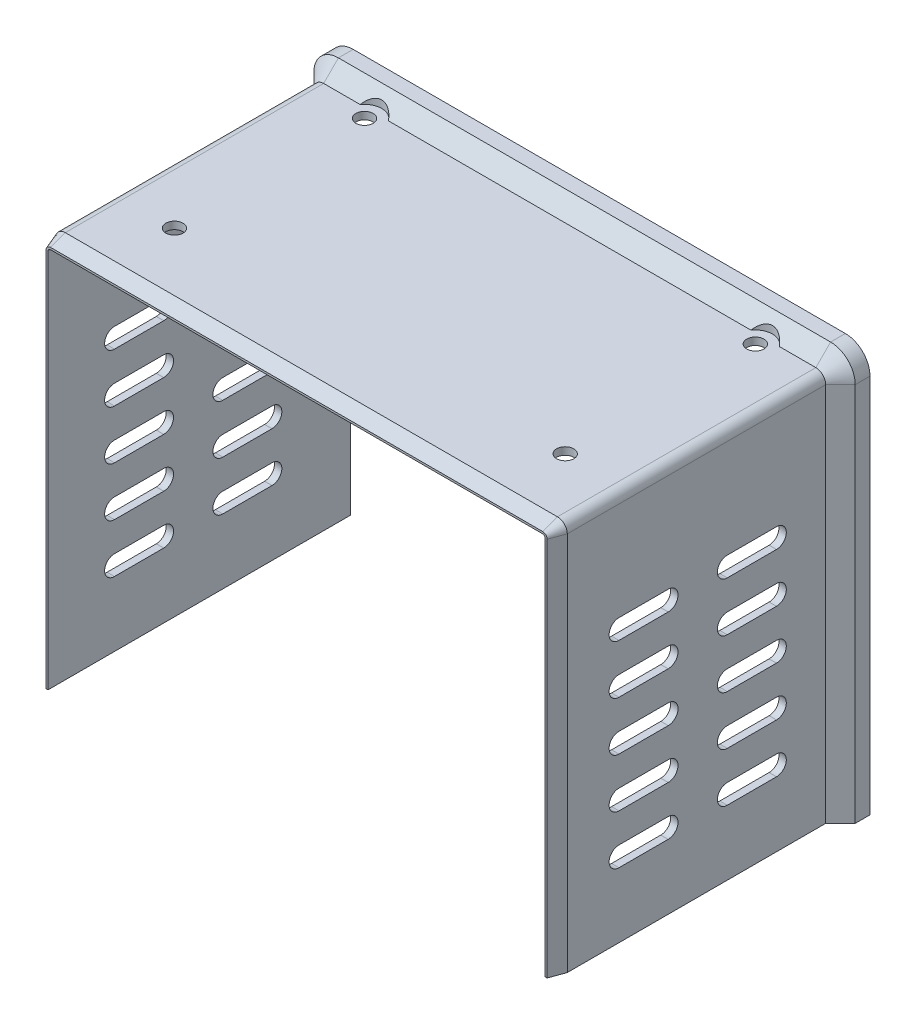
from build123d import *
from OCP.BRepFilletAPI import BRepFilletAPI_MakeChamfer

# Parameters (mm, degrees)
BOSS_EXTRUDE1_DEPTH = 61.5
CHAMFER1_SIZE       = 3
CHAMFER1_SIZE2      = 1.091910703
SKETCH4_R           = 1.75
CUT_EXTRUDE1_DEPTH  = 10
BOSS_EXTRUDE2_DEPTH = 3
CHAMFER2_SIZE       = 3
CUT_EXTRUDE2_DEPTH  = 145
SKETCH7_R           = 3.5
CUT_EXTRUDE3_DEPTH  = 10


with BuildPart() as part:
    # Sketch3 → Boss-Extrude1 (new body)
    with BuildSketch(Plane.XY.offset(389.620141885)):
        with BuildLine():
            Line((-161.210843614, -470.098939869), (-61.210843614, -470.098939869))
            ThreePointArc((-61.210843614, -470.098939869), (-60.857290223, -470.245386479), (-60.710843614, -470.598939869))
            Line((-60.710843614, -470.598939869), (-60.710843614, -547.798939869))
            Line((-60.710843614, -547.798939869), (-59.210843614, -547.798939869))
            Line((-59.210843614, -547.798939869), (-59.210843614, -470.598939869))
            ThreePointArc((-59.210843614, -470.598939869), (-59.796630051, -469.184726307), (-61.210843614, -468.598939869))
            Line((-61.210843614, -468.598939869), (-161.210843614, -468.598939869))
            ThreePointArc((-161.210843614, -468.598939869), (-162.625057176, -469.184726307), (-163.210843614, -470.598939869))
            Line((-163.210843614, -470.598939869), (-163.210843614, -547.798939869))
            Line((-163.210843614, -547.798939869), (-161.710843614, -547.798939869))
            Line((-161.710843614, -547.798939869), (-161.710843614, -544.99774542))
            Line((-161.710843614, -544.99774542), (-161.710843614, -470.598939869))
            ThreePointArc((-161.710843614, -470.598939869), (-161.564397004, -470.245386479), (-161.210843614, -470.098939869))
        make_face()
    extrude(amount=BOSS_EXTRUDE1_DEPTH)

    # Chamfer1: one chamfer whose edges measure the first distance from different faces: ONE call of the kernel's chamfer builder (chamfer() names one face for all edges)
    chamfer1_edges_1 = [part.edges().sort_by_distance(p)[0] for p in [
        (-59.796630051, -469.184726307, 451.120141885),
    ]]
    chamfer1_side_1 = [part.faces().sort_by_distance(p)[0] for p in [
        (-59.796630051, -469.184726307, 420.370141885),
    ]]
    chamfer1_edges_2 = [part.edges().sort_by_distance(p)[0] for p in [
        (-111.210843614, -468.598939869, 451.120141885),
    ]]
    chamfer1_side_2 = [part.faces().sort_by_distance(p)[0] for p in [
        (-111.210843614, -468.598939869, 420.370141885),
    ]]
    chamfer1_edges_3 = [part.edges().sort_by_distance(p)[0] for p in [
        (-162.625057176, -469.184726307, 451.120141885),
    ]]
    chamfer1_side_3 = [part.faces().sort_by_distance(p)[0] for p in [
        (-162.625057176, -469.184726307, 420.370141885),
    ]]
    chamfer1_edges_4 = [part.edges().sort_by_distance(p)[0] for p in [
        (-163.210843614, -509.198939869, 451.120141885),
    ]]
    chamfer1_side_4 = [part.faces().sort_by_distance(p)[0] for p in [
        (-163.210843614, -509.198939869, 420.370141885),
    ]]
    chamfer1_edges_5 = [part.edges().sort_by_distance(p)[0] for p in [
        (-59.210843614, -509.198939869, 451.120141885),
    ]]
    chamfer1_side_5 = [part.faces().sort_by_distance(p)[0] for p in [
        (-59.210843614, -509.198939869, 420.370141885),
    ]]
    chamfer1 = BRepFilletAPI_MakeChamfer(part.part.solid().wrapped)
    for e in chamfer1_edges_1:
        chamfer1.Add(CHAMFER1_SIZE, CHAMFER1_SIZE2, e.wrapped, chamfer1_side_1[0].wrapped)  # the first distance lies on this face
    for e in chamfer1_edges_2:
        chamfer1.Add(CHAMFER1_SIZE, CHAMFER1_SIZE2, e.wrapped, chamfer1_side_2[0].wrapped)  # the first distance lies on this face
    for e in chamfer1_edges_3:
        chamfer1.Add(CHAMFER1_SIZE, CHAMFER1_SIZE2, e.wrapped, chamfer1_side_3[0].wrapped)  # the first distance lies on this face
    for e in chamfer1_edges_4:
        chamfer1.Add(CHAMFER1_SIZE, CHAMFER1_SIZE2, e.wrapped, chamfer1_side_4[0].wrapped)  # the first distance lies on this face
    for e in chamfer1_edges_5:
        chamfer1.Add(CHAMFER1_SIZE, CHAMFER1_SIZE2, e.wrapped, chamfer1_side_5[0].wrapped)  # the first distance lies on this face
    add(Compound.cast(chamfer1.Shape()), mode=Mode.REPLACE)

    # Sketch4 → Cut-Extrude1 (cut)
    with BuildSketch(Plane(origin=(0, -468.598939869, 0), x_dir=(1, 0, 0), z_dir=(0, 1, 0))):
        with Locations(Location((-150.910843614, -397.620141885, 0), (0, 0, 270))):
            Circle(SKETCH4_R)
        with Locations(Location((-71.510843614, -397.620141885, 0), (0, 0, 270))):
            Circle(SKETCH4_R)
        with Locations(Location((-71.510843614, -436.241358014, 0), (0, 0, 270))):
            Circle(SKETCH4_R)
        with Locations(Location((-150.910843614, -436.241358014, 0), (0, 0, 270))):
            Circle(SKETCH4_R)
    extrude(amount=-CUT_EXTRUDE1_DEPTH, mode=Mode.SUBTRACT)

    # Sketch5 → Boss-Extrude2 (add)
    with BuildSketch(Plane(origin=(0, 0, 389.620141885), x_dir=(-1, 0, 0), z_dir=(0, 0, -1))):
        with BuildLine():
            Line((59.310843614, -547.798939869), (59.310843614, -470.598939869))
            ThreePointArc((59.310843614, -470.598939869), (59.867340729, -469.255436985), (61.210843614, -468.698939869))
            Line((61.210843614, -468.698939869), (161.210843614, -468.698939869))
            ThreePointArc((161.210843614, -468.698939869), (162.554346498, -469.255436985), (163.110843614, -470.598939869))
            Line((163.110843614, -470.598939869), (163.110843614, -547.798939869))
            Line((163.110843614, -547.798939869), (166.210843614, -547.798939869))
            Line((166.210843614, -547.798939869), (166.210843614, -470.598939869))
            ThreePointArc((166.210843614, -470.598939869), (164.74637752, -467.063405963), (161.210843614, -465.598939869))
            Line((161.210843614, -465.598939869), (61.210843614, -465.598939869))
            ThreePointArc((61.210843614, -465.598939869), (57.675309708, -467.063405963), (56.210843614, -470.598939869))
            Line((56.210843614, -470.598939869), (56.210843614, -547.798939869))
            Line((56.210843614, -547.798939869), (59.310843614, -547.798939869))
        make_face()
    extrude(amount=-BOSS_EXTRUDE2_DEPTH)

    # Chamfer2
    chamfer2_edges = [part.edges().sort_by_distance(p)[0] for p in [
        (-163.210843614, -509.198939869, 392.620141885),
        (-162.625057176, -469.184726307, 392.620141885),
        (-111.210843614, -468.598939869, 392.620141885),
        (-59.796630051, -469.184726307, 392.620141885),
        (-59.210843614, -509.198939869, 392.620141885),
    ]]
    chamfer(chamfer2_edges, length=CHAMFER2_SIZE - 0.0001)  # a hair under: the kernel refuses the full size

    # Sketch6 → Cut-Extrude2 (cut)
    with BuildSketch(Plane(origin=(-59.210843614, 0, 0), x_dir=(0, 0, -1), z_dir=(1, 0, 0))):
        with BuildLine():
            Line((-437.620141885, -490.598939869), (-427.620141885, -490.598939869))
            ThreePointArc((-427.620141885, -490.598939869), (-425.620141885, -492.598939869), (-427.620141885, -494.598939869))
            Line((-427.620141885, -494.598939869), (-437.620141885, -494.598939869))
            ThreePointArc((-437.620141885, -494.598939869), (-439.620141885, -492.598939869), (-437.620141885, -490.598939869))
        make_face()
        with BuildLine():
            Line((-415.620141885, -490.598939869), (-405.620141885, -490.598939869))
            ThreePointArc((-405.620141885, -490.598939869), (-403.620141885, -492.598939869), (-405.620141885, -494.598939869))
            Line((-405.620141885, -494.598939869), (-415.620141885, -494.598939869))
            ThreePointArc((-415.620141885, -494.598939869), (-417.620141885, -492.598939869), (-415.620141885, -490.598939869))
        make_face()
        with BuildLine():
            Line((-437.620141885, -500.598939869), (-427.620141885, -500.598939869))
            ThreePointArc((-427.620141885, -500.598939869), (-425.620141885, -502.598939869), (-427.620141885, -504.598939869))
            Line((-427.620141885, -504.598939869), (-437.620141885, -504.598939869))
            ThreePointArc((-437.620141885, -504.598939869), (-439.620141885, -502.598939869), (-437.620141885, -500.598939869))
        make_face()
        with BuildLine():
            Line((-415.620141885, -500.598939869), (-405.620141885, -500.598939869))
            ThreePointArc((-405.620141885, -500.598939869), (-403.620141885, -502.598939869), (-405.620141885, -504.598939869))
            Line((-405.620141885, -504.598939869), (-415.620141885, -504.598939869))
            ThreePointArc((-415.620141885, -504.598939869), (-417.620141885, -502.598939869), (-415.620141885, -500.598939869))
        make_face()
        with BuildLine():
            Line((-437.620141885, -510.598939869), (-427.620141885, -510.598939869))
            ThreePointArc((-427.620141885, -510.598939869), (-425.620141885, -512.598939869), (-427.620141885, -514.598939869))
            Line((-427.620141885, -514.598939869), (-437.620141885, -514.598939869))
            ThreePointArc((-437.620141885, -514.598939869), (-439.620141885, -512.598939869), (-437.620141885, -510.598939869))
        make_face()
        with BuildLine():
            Line((-415.620141885, -510.598939869), (-405.620141885, -510.598939869))
            ThreePointArc((-405.620141885, -510.598939869), (-403.620141885, -512.598939869), (-405.620141885, -514.598939869))
            Line((-405.620141885, -514.598939869), (-415.620141885, -514.598939869))
            ThreePointArc((-415.620141885, -514.598939869), (-417.620141885, -512.598939869), (-415.620141885, -510.598939869))
        make_face()
        with BuildLine():
            Line((-437.620141885, -520.598939869), (-427.620141885, -520.598939869))
            ThreePointArc((-427.620141885, -520.598939869), (-425.620141885, -522.598939869), (-427.620141885, -524.598939869))
            Line((-427.620141885, -524.598939869), (-437.620141885, -524.598939869))
            ThreePointArc((-437.620141885, -524.598939869), (-439.620141885, -522.598939869), (-437.620141885, -520.598939869))
        make_face()
        with BuildLine():
            Line((-415.620141885, -520.598939869), (-405.620141885, -520.598939869))
            ThreePointArc((-405.620141885, -520.598939869), (-403.620141885, -522.598939869), (-405.620141885, -524.598939869))
            Line((-405.620141885, -524.598939869), (-415.620141885, -524.598939869))
            ThreePointArc((-415.620141885, -524.598939869), (-417.620141885, -522.598939869), (-415.620141885, -520.598939869))
        make_face()
        with BuildLine():
            Line((-437.620141885, -530.598939869), (-427.620141885, -530.598939869))
            ThreePointArc((-427.620141885, -530.598939869), (-425.620141885, -532.598939869), (-427.620141885, -534.598939869))
            Line((-427.620141885, -534.598939869), (-437.620141885, -534.598939869))
            ThreePointArc((-437.620141885, -534.598939869), (-439.620141885, -532.598939869), (-437.620141885, -530.598939869))
        make_face()
        with BuildLine():
            Line((-415.620141885, -530.598939869), (-405.620141885, -530.598939869))
            ThreePointArc((-405.620141885, -530.598939869), (-403.620141885, -532.598939869), (-405.620141885, -534.598939869))
            Line((-405.620141885, -534.598939869), (-415.620141885, -534.598939869))
            ThreePointArc((-415.620141885, -534.598939869), (-417.620141885, -532.598939869), (-415.620141885, -530.598939869))
        make_face()
    extrude(amount=-CUT_EXTRUDE2_DEPTH, mode=Mode.SUBTRACT)

    # Sketch7 → Cut-Extrude3 (cut)
    with BuildSketch(Plane(origin=(0, -468.598939869, 0), x_dir=(1, 0, 0), z_dir=(0, 1, 0))):
        with Locations((-150.910843614, -397.620141885)):
            Circle(SKETCH7_R)
        with Locations((-71.510843614, -397.620141885)):
            Circle(SKETCH7_R)
    extrude(amount=CUT_EXTRUDE3_DEPTH, mode=Mode.SUBTRACT)


solid = part.part
